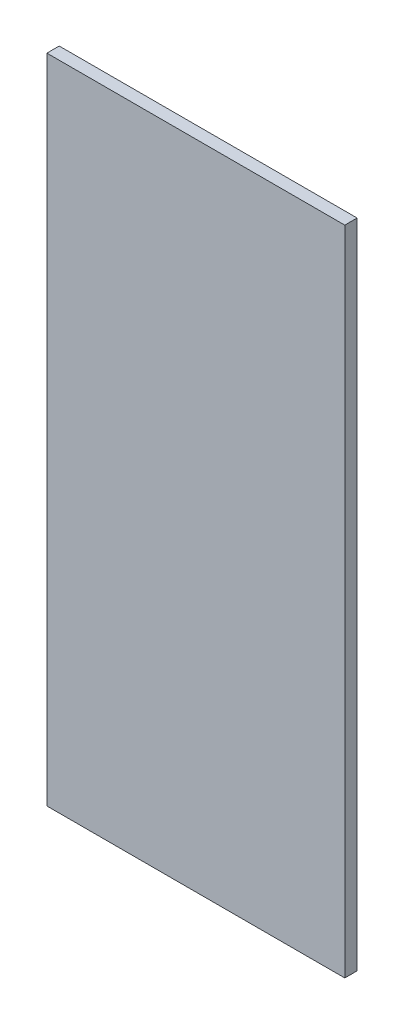
from build123d import *

# Parameters (mm, degrees)
SKETCH1_W           = 145
SKETCH1_H           = 317.37
BOSS_EXTRUDE1_DEPTH = 6


with BuildPart() as part:
    # Sketch1 → Boss-Extrude1 (new body)
    with BuildSketch(Plane.XY):
        Rectangle(SKETCH1_W, SKETCH1_H)
    extrude(amount=BOSS_EXTRUDE1_DEPTH)


solid = part.part
